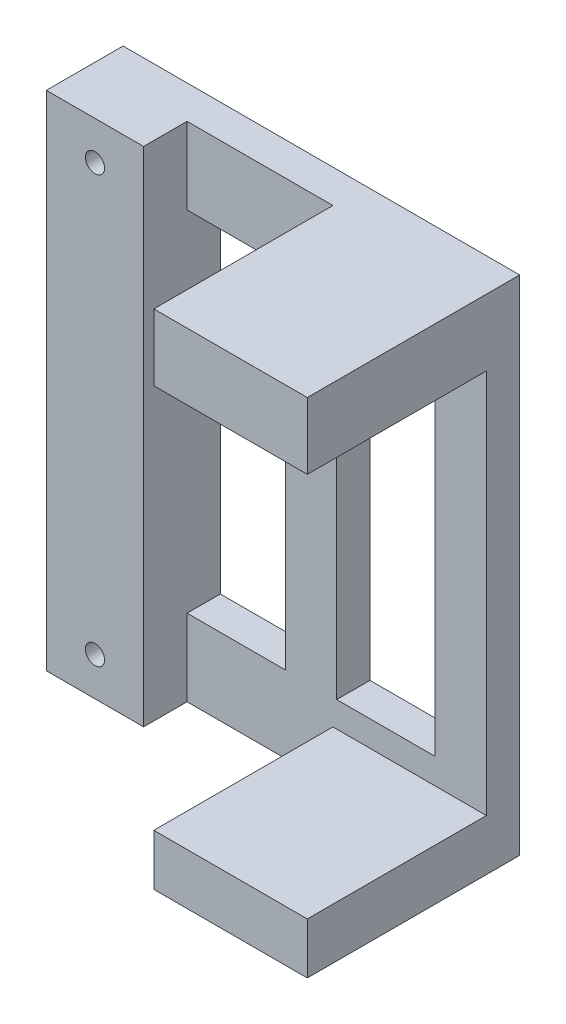
from build123d import *

# Parameters (mm, degrees)
SKETCH_2_W          = 15.5
SKETCH_2_H          = 19.65
SKETCH_2_W_2        = 3.85
SKETCH_2_H_2        = 13.65
EXTRUDE_1_DEPTH     = 1.3
SKETCH_3_W          = 6
SKETCH_3_H          = 2.6
SKETCH_3_H_2        = 2
EXTRUDE_2_DEPTH     = 7
SKETCH_10_W         = 3.8
SKETCH_10_H         = 19.65
EXTRUDE_4_DEPTH     = 1.7
CUT_EXTRUDE_2_REACH = 18.544
CUT_EXTRUDE_START   = 1.7
SKETCH_9_R          = 0.375


with BuildPart() as part:
    # 草图2 → 凸台-拉伸1 (new body)
    with BuildSketch(Plane.XY):
        with Locations((-0.9, 0)):
            Rectangle(SKETCH_2_W, SKETCH_2_H)
        with Locations((-2.925, 0)):
            Rectangle(SKETCH_2_W_2, SKETCH_2_H_2, mode=Mode.SUBTRACT)
        with Locations((2.925, 0)):
            Rectangle(SKETCH_2_W_2, SKETCH_2_H_2, mode=Mode.SUBTRACT)
    extrude(amount=EXTRUDE_1_DEPTH)

    # 草图3 → 凸台-拉伸2 (add)
    with BuildSketch(Plane.XY.offset(1.3)):
        with Locations((3.85, 8.525)):
            Rectangle(SKETCH_3_W, SKETCH_3_H)
        with Locations((3.85, -8.825)):
            Rectangle(SKETCH_3_W, SKETCH_3_H_2)
    extrude(amount=EXTRUDE_2_DEPTH)

    # 草图10 → 凸台-拉伸4 (add)
    with BuildSketch(Plane.XY.offset(1.3)):
        with Locations((-6.75, 0)):
            Rectangle(SKETCH_10_W, SKETCH_10_H)
    extrude(amount=EXTRUDE_4_DEPTH)

    # 草图9 → 切除-拉伸2 (cut, up to next)
    with BuildSketch(Plane.XY.offset(1.3).offset(CUT_EXTRUDE_START), mode=Mode.PRIVATE) as cut_extrude_2_sk1:
        with Locations((-6.75, 8.325)):
            Circle(SKETCH_9_R)
    cut_extrude_2_tool1 = extrude(cut_extrude_2_sk1.sketch, amount=-CUT_EXTRUDE_2_REACH, mode=Mode.PRIVATE) & part.part
    # 草图9 → 切除-拉伸2 (cut, up to next)
    with BuildSketch(Plane.XY.offset(1.3).offset(CUT_EXTRUDE_START), mode=Mode.PRIVATE) as cut_extrude_2_sk2:
        with Locations((-6.75, -8.325)):
            Circle(SKETCH_9_R)
    cut_extrude_2_tool2 = extrude(cut_extrude_2_sk2.sketch, amount=-CUT_EXTRUDE_2_REACH, mode=Mode.PRIVATE) & part.part
    add(cut_extrude_2_tool1.solids().sort_by_distance((-6.75, 8.325, 3))[0], mode=Mode.SUBTRACT)
    add(cut_extrude_2_tool2.solids().sort_by_distance((-6.75, -8.325, 3))[0], mode=Mode.SUBTRACT)


solid = part.part
